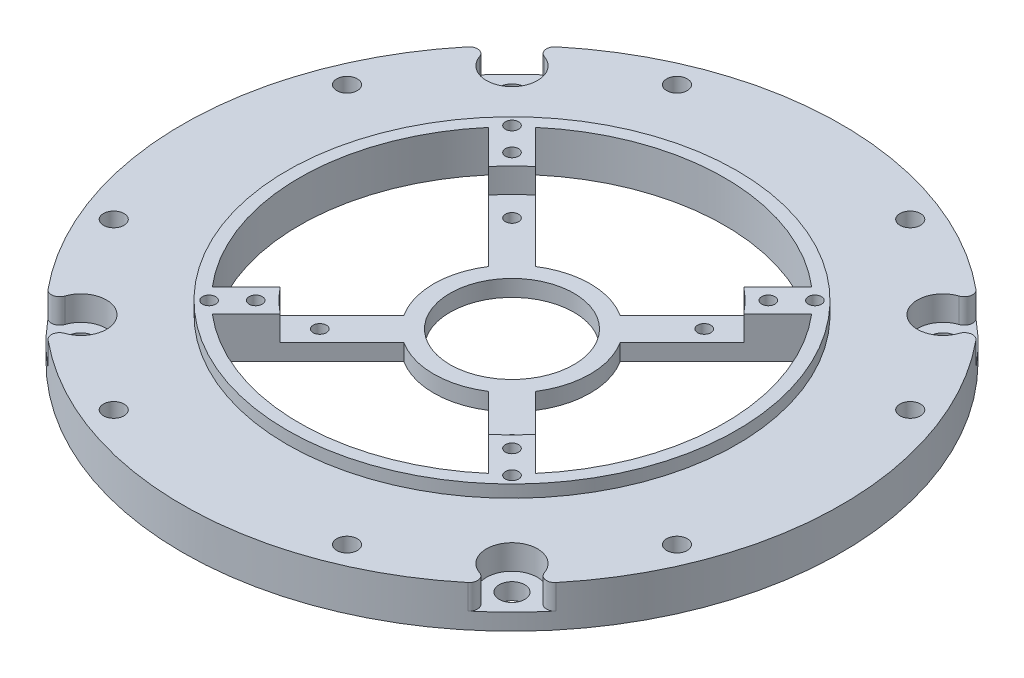
from build123d import *

# Parameters (mm, degrees)
SKETCH_1_R                       = 40
EXTRUDE_1_DEPTH                  = 5
CUT_EXTRUDE_1_DEPTH              = 57.789083458
CUT_EXTRUDE_1_DEPTH_BACK         = 1.5
SKETCH_2_R                       = 33.5
SKETCH_7_R                       = 27.3
EXTRUDE_3_DEPTH                  = 1.5
SKETCH_3_R                       = 25.8
CUT_EXTRUDE_2_DEPTH              = 57.940758688
EXTRUDE_2_DEPTH                  = 5
CUT_EXTRUDE_3_DEPTH              = 57.789083458
CUT_EXTRUDE_3_DEPTH_BACK         = 4
SKETCH_5_R                       = 7.515
CUT_EXTRUDE_4_DEPTH              = 57.835288334
CUT_EXTRUDE_4_DEPTH_BACK         = 57.835288334
SKETCH_6_R                       = 6.5
SKETCH_8_R                       = 20
SKETCH_8_R_2                     = 4.5
CUT_EXTRUDE_5_DEPTH              = 3
HOLE_WIZARD_M2_1_D               = 1.6
HOLE_WIZARD_M2_6_D               = 1.6
HOLE_WIZARD_M3_1_OUTLINE_R       = 1.25
HOLE_WIZARD_M3_1_DEPTH           = 5
SKETCH_25_R                      = 3.1
CUT_EXTRUDE_7_DEPTH              = 3
SKETCH_26_R                      = 1.55
CUT_EXTRUDE_8_DEPTH              = 57.747246629
FILLET_1_R                       = 1
PATTERN_CIRCULAR_1_COUNT         = 4
FILLET_1_OF_PATTERN_CIRCULAR_1_R = 1


# Read off the part's stored shape, not the designer's step: M3 螺纹孔1
with BuildPart() as part:
    # 草图1 → 凸台-拉伸1 (new body)
    with BuildSketch(Plane(origin=(0, 0, 0), x_dir=(1, 0, 0), z_dir=(0, 1, 0))):
        with Locations(Location((0, 0, 0), (0, 0, 270))):
            Circle(SKETCH_1_R)
    extrude(amount=EXTRUDE_1_DEPTH)

    # 草图2 → 切除-拉伸1 (cut, two sides: drawn at the far end of the back side and taken through both)
    with BuildSketch(Plane.XZ.offset(-CUT_EXTRUDE_1_DEPTH_BACK)):
        with Locations(Location((0, 0, 0), (0, 0, 90))):
            Circle(SKETCH_2_R)
    extrude(amount=CUT_EXTRUDE_1_DEPTH + CUT_EXTRUDE_1_DEPTH_BACK, mode=Mode.SUBTRACT)

    # 草图7 → 凸台-拉伸3 (add)
    with BuildSketch(Plane(origin=(0, 5, 0), x_dir=(1, 0, 0), z_dir=(0, 1, 0))):
        with Locations(Location((0, 0, 0), (0, 0, 270))):
            Circle(SKETCH_7_R)
    extrude(amount=EXTRUDE_3_DEPTH)

    # 草图3 → 切除-拉伸2 (cut, through all)
    with BuildSketch(Plane(origin=(0, 6.5, 0), x_dir=(1, 0, 0), z_dir=(0, 1, 0))):
        with Locations(Location((0, 0, 0), (0, 0, 270))):
            Circle(SKETCH_3_R)
    extrude(amount=-CUT_EXTRUDE_2_DEPTH, mode=Mode.SUBTRACT)

    # 草图4 → 凸台-拉伸2 (add)
    with BuildSketch(Plane.XZ.offset(-1.5)):
        with BuildLine():
            Line((-19.657568517, 16.829141392), (-7.981176331, 5.152749206))
            ThreePointArc((-7.981176331, 5.152749206), (-9.5, 0), (-7.981176331, -5.152749206))
            Line((-7.981176331, -5.152749206), (-19.657568517, -16.829141392))
            Line((-19.657568517, -16.829141392), (-16.829141392, -19.657568517))
            Line((-16.829141392, -19.657568517), (-5.152749206, -7.981176331))
            ThreePointArc((-5.152749206, -7.981176331), (0, -9.5), (5.152749206, -7.981176331))
            Line((5.152749206, -7.981176331), (16.829141392, -19.657568517))
            Line((16.829141392, -19.657568517), (19.657568517, -16.829141392))
            Line((19.657568517, -16.829141392), (7.981176331, -5.152749206))
            ThreePointArc((7.981176331, -5.152749206), (9.5, 0), (7.981176331, 5.152749206))
            Line((7.981176331, 5.152749206), (19.657568517, 16.829141392))
            Line((19.657568517, 16.829141392), (16.829141392, 19.657568517))
            Line((16.829141392, 19.657568517), (5.152749206, 7.981176331))
            ThreePointArc((5.152749206, 7.981176331), (0, 9.5), (-5.152749206, 7.981176331))
            Line((-5.152749206, 7.981176331), (-16.829141392, 19.657568517))
            Line((-16.829141392, 19.657568517), (-19.657568517, 16.829141392))
        make_face()
    extrude(amount=-EXTRUDE_2_DEPTH)

    # 草图5 → 切除-拉伸3 (cut, two sides: drawn at the far end of the back side and taken through both)
    with BuildSketch(Plane.XZ.offset(-1.5).offset(-CUT_EXTRUDE_3_DEPTH_BACK)):
        with Locations(Location((0, 0, 0), (0, 0, 270))):
            Circle(SKETCH_5_R)
    extrude(amount=CUT_EXTRUDE_3_DEPTH + CUT_EXTRUDE_3_DEPTH_BACK, mode=Mode.SUBTRACT)

    # 草图6 → 切除-拉伸4 (cut, two sides: drawn at the far end of the back side and taken through both)
    with BuildSketch(Plane.XZ.offset(-5.5).offset(-CUT_EXTRUDE_4_DEPTH_BACK)):
        with Locations(Location((0, 0, 0), (0, 0, 270))):
            Circle(SKETCH_6_R)
    extrude(amount=CUT_EXTRUDE_4_DEPTH + CUT_EXTRUDE_4_DEPTH_BACK, mode=Mode.SUBTRACT)

    # 草图8 → 切除-拉伸5 (cut)
    with BuildSketch(Plane(origin=(0, 6.5, 0), x_dir=(1, 0, 0), z_dir=(0, 1, 0))):
        Circle(SKETCH_8_R)
        Circle(SKETCH_8_R_2, mode=Mode.SUBTRACT)
    extrude(amount=-CUT_EXTRUDE_5_DEPTH, mode=Mode.SUBTRACT)

    # M2 螺纹孔1 (through all)
    with Locations(Plane(origin=(0, 3.5, 0), x_dir=(1, 0, 0), z_dir=(0, 1, 0))):
        with Locations((0, 0), (-11.66726189, 11.66726189), (11.66726189, 11.66726189), (11.66726189, -11.66726189), (-11.66726189, -11.66726189)):
            Hole(HOLE_WIZARD_M2_1_D / 2)

    # M2 螺纹孔6 (through all)
    with Locations(Plane(origin=(0, 6.5, 0), x_dir=(1, 0, 0), z_dir=(0, 1, 0))):
        with Locations((15.556349186, 15.556349186), (0, 0), (-15.556349186, 15.556349186), (-15.556349186, -15.556349186), (15.556349186, -15.556349186), (-18.384776311, 18.384776311), (18.384776311, 18.384776311), (18.384776311, -18.384776311), (-18.384776311, -18.384776311)):
            Hole(HOLE_WIZARD_M2_6_D / 2)

    # M3 螺纹孔1 outline → M3 螺纹孔1 (cut)
    with BuildSketch(Plane(origin=(0, 0, 0), x_dir=(1, 0, 0), z_dir=(0, 1, 0))):
        with Locations((34.183542703, 14.159286998)):
            Circle(HOLE_WIZARD_M3_1_OUTLINE_R)
        with Locations((34.183542703, -14.159286998)):
            Circle(HOLE_WIZARD_M3_1_OUTLINE_R)
        with Locations((14.159286998, -34.183542703)):
            Circle(HOLE_WIZARD_M3_1_OUTLINE_R)
        with Locations((-14.159286998, -34.183542703)):
            Circle(HOLE_WIZARD_M3_1_OUTLINE_R)
        with Locations((-34.183542703, -14.159286998)):
            Circle(HOLE_WIZARD_M3_1_OUTLINE_R)
        with Locations((-34.183542703, 14.159286998)):
            Circle(HOLE_WIZARD_M3_1_OUTLINE_R)
        with Locations((-14.159286998, 34.183542703)):
            Circle(HOLE_WIZARD_M3_1_OUTLINE_R)
        with Locations((14.159286998, 34.183542703)):
            Circle(HOLE_WIZARD_M3_1_OUTLINE_R)
    extrude(amount=HOLE_WIZARD_M3_1_DEPTH, mode=Mode.SUBTRACT)

    # 草图25 → 切除-拉伸7 (cut)
    with BuildSketch(Plane(origin=(0, 5, 0), x_dir=(1, 0, 0), z_dir=(0, 1, 0))):
        with Locations((-26.162950904, -26.162950904)):
            Circle(SKETCH_25_R)
    cut_extrude_7 = extrude(amount=-CUT_EXTRUDE_7_DEPTH, mode=Mode.SUBTRACT)

    # 草图26 → 切除-拉伸8 (cut, through all)
    with BuildSketch(Plane(origin=(0, 2, 0), x_dir=(1, 0, 0), z_dir=(0, 1, 0))):
        with Locations(Location((-26.162950904, -26.162950904, 0), (0, 0, 270))):
            Circle(SKETCH_26_R)
    cut_extrude_8 = extrude(amount=-CUT_EXTRUDE_8_DEPTH, mode=Mode.SUBTRACT)

    # 圆角1
    fillet_1_edges = [part.edges().sort_by_distance(p)[0] for p in [
        (-28.852633786, 3.5, 27.704251003),
        (-27.704251003, 3.5, 28.852633786),
    ]]
    fillet(fillet_1_edges, radius=FILLET_1_R)

    # 阵列(圆周)1: 切除-拉伸7, 切除-拉伸8 ×4 about axis
    pattern_circular_1_axis = Axis((0, 0, 0), (0, 1, 0))
    add([cut_extrude_7.rotate(pattern_circular_1_axis, i * 360 / PATTERN_CIRCULAR_1_COUNT) for i in range(1, PATTERN_CIRCULAR_1_COUNT)], mode=Mode.SUBTRACT)
    add([cut_extrude_8.rotate(pattern_circular_1_axis, i * 360 / PATTERN_CIRCULAR_1_COUNT) for i in range(1, PATTERN_CIRCULAR_1_COUNT)], mode=Mode.SUBTRACT)

    # 圆角1 of 阵列(圆周)1
    fillet_1_of_pattern_circular_1_edges = [part.edges().sort_by_distance(p)[0] for p in [
        (27.704251003, 3.5, 28.852633786),
        (28.852633786, 3.5, 27.704251003),
        (28.852633786, 3.5, -27.704251003),
        (27.704251003, 3.5, -28.852633786),
        (-27.704251003, 3.5, -28.852633786),
        (-28.852633786, 3.5, -27.704251003),
    ]]
    fillet(fillet_1_of_pattern_circular_1_edges, radius=FILLET_1_OF_PATTERN_CIRCULAR_1_R)


solid = part.part
